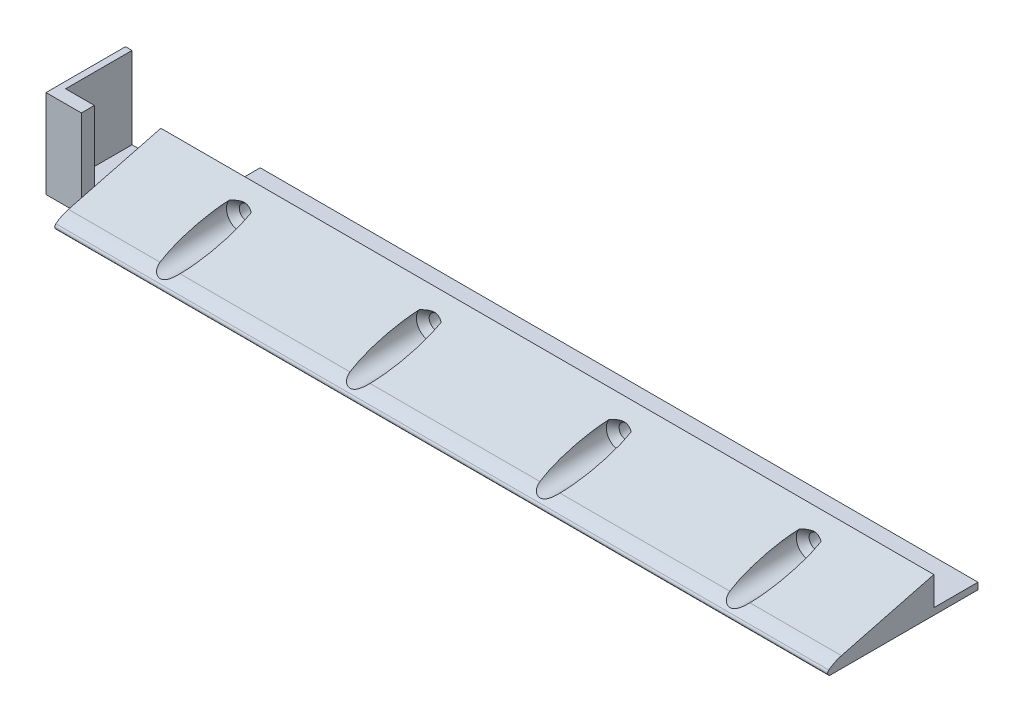
from build123d import *

# Parameters (mm, degrees)
BOSS_EXTRUDE1_DEPTH                          = 175
FILLET1_R                                    = 8
CSK_FOR_M3_COUNTERSUNK_FLAT_HEAD_SCR_2_COUNT = 2
CSK_FOR_M3_COUNTERSUNK_FLAT_HEAD_SCR_2_PITCH = 129
CSK_FOR_M3_COUNTERSUNK_FLAT_HEAD_SCR_3_COUNT = 2
CSK_FOR_M3_COUNTERSUNK_FLAT_HEAD_SCR_3_PITCH = 86
CSK_FOR_M3_COUNTERSUNK_FLAT_HEAD_SCR_4_COUNT = 2
CSK_FOR_M3_COUNTERSUNK_FLAT_HEAD_SCR_4_PITCH = 43
CUT_EXTRUDE2_DEPTH                           = 177.259042321
SKETCH8_W                                    = 12.5
SKETCH8_H                                    = 10
CUT_EXTRUDE3_DEPTH                           = 177.896156092
SKETCH10_W                                   = 8
SKETCH10_H                                   = 18
BOSS_EXTRUDE2_DEPTH                          = 1.5
BOSS_EXTRUDE3_DEPTH                          = 18.5
FILLET2_R                                    = 0.65


with BuildPart() as part:
    # Sketch1 → Boss-Extrude1 (new body)
    with BuildSketch(Plane(origin=(0, 0, 0), x_dir=(0, 0, -1), z_dir=(1, 0, 0))):
        Polygon((0, 6.5), (-25, 0), (-25, -1.5), (10, -1.5), (10, 0), (0, 0), align=None)
    extrude(amount=BOSS_EXTRUDE1_DEPTH)

    # Fillet1
    # the kernel refuses this fillet: 8 mm, written as the material it takes off along each edge
    with BuildSketch(Plane(origin=(-10.545555265, 0, 25), x_dir=(0, 0.2516338517649508, -0.967822506788272), z_dir=(1, 0, 0))) as fillet1_piece_1:
        with BuildLine():
            CenterArc((4.218222106, -8), FILLET1_R, 90, 35.061762164)
            Line((-0.377450778, -1.45173376), (-0.469364235, -1.320768435))
            ThreePointArc((-0.469364235, -1.320768435), (-0.34357699, -0.685605464), (-0.154851601, 0.040261416))
            Line((-0.154851601, 0.040261416), (0, 0.16))
            Line((0, 0.16), (4.218222106, 0.16))
            Line((4.218222106, 0.16), (4.218222106, 0))
        make_face()
    extrude(amount=196.091110529, mode=Mode.SUBTRACT)

    # Sketch5 → CSK for M3 Countersunk Flat Head Screw1 (revolve, cut)
    with BuildSketch(Plane(origin=(152, 3.25, 5), x_dir=(0, -1, 0), z_dir=(1, 0, 0))):
        Polygon((0, 0), (0, 15), (1.7, 15), (1.7, 1.45), (3.15, 0), align=None)
    csk_for_m3_countersunk_flat_head_screw1 = revolve(axis=Axis((152, 3.25, 11.35), (0, 0, -1)), mode=Mode.SUBTRACT)

    # CSK for M3 Countersunk Flat Head Scr 2: CSK for M3 Countersunk Flat Head Screw1 ×2
    with Locations(*[(-i * CSK_FOR_M3_COUNTERSUNK_FLAT_HEAD_SCR_2_PITCH, 0, 0) for i in range(1, CSK_FOR_M3_COUNTERSUNK_FLAT_HEAD_SCR_2_COUNT)]):
        add(csk_for_m3_countersunk_flat_head_screw1, mode=Mode.SUBTRACT)

    # CSK for M3 Countersunk Flat Head Scr 3: CSK for M3 Countersunk Flat Head Screw1 ×2
    with Locations(*[(-i * CSK_FOR_M3_COUNTERSUNK_FLAT_HEAD_SCR_3_PITCH, 0, 0) for i in range(1, CSK_FOR_M3_COUNTERSUNK_FLAT_HEAD_SCR_3_COUNT)]):
        add(csk_for_m3_countersunk_flat_head_screw1, mode=Mode.SUBTRACT)

    # CSK for M3 Countersunk Flat Head Scr 4: CSK for M3 Countersunk Flat Head Screw1 ×2
    with Locations(*[(-i * CSK_FOR_M3_COUNTERSUNK_FLAT_HEAD_SCR_4_PITCH, 0, 0) for i in range(1, CSK_FOR_M3_COUNTERSUNK_FLAT_HEAD_SCR_4_COUNT)]):
        add(csk_for_m3_countersunk_flat_head_screw1, mode=Mode.SUBTRACT)

    # Sketch7 → Cut-Extrude2 (cut, through all)
    with BuildSketch(Plane(origin=(0, 0, 5), x_dir=(-1, 0, 0), z_dir=(0, 0, -1))):
        with BuildLine():
            Line((-149.526136625, 5.2), (-154.473863375, 5.2))
            ThreePointArc((-154.473863375, 5.2), (-152, 0.1), (-149.526136625, 5.2))
        make_face()
        with BuildLine():
            Line((-20.526136625, 5.2), (-25.473863375, 5.2))
            ThreePointArc((-25.473863375, 5.2), (-23, 0.1), (-20.526136625, 5.2))
        make_face()
        with BuildLine():
            Line((-63.526136625, 5.2), (-68.473863375, 5.2))
            ThreePointArc((-68.473863375, 5.2), (-66, 0.1), (-63.526136625, 5.2))
        make_face()
        with BuildLine():
            Line((-106.526136625, 5.2), (-111.473863375, 5.2))
            ThreePointArc((-111.473863375, 5.2), (-109, 0.1), (-106.526136625, 5.2))
        make_face()
    extrude(amount=-CUT_EXTRUDE2_DEPTH, mode=Mode.SUBTRACT)

    # Sketch8 → Cut-Extrude3 (cut, through all)
    with BuildSketch(Plane(origin=(0, 0, 0), x_dir=(1, 0, 0), z_dir=(0, 1, 0))):
        with Locations((6.25, 5)):
            Rectangle(SKETCH8_W, SKETCH8_H)
    extrude(amount=-CUT_EXTRUDE3_DEPTH, mode=Mode.SUBTRACT)

    # Sketch10 → Boss-Extrude2 (add)
    with BuildSketch(Plane.XZ.offset(1.5)):
        with Locations((-4, 9)):
            Rectangle(SKETCH10_W, SKETCH10_H)
    extrude(amount=-BOSS_EXTRUDE2_DEPTH)

    # Sketch11 → Boss-Extrude3 (add)
    with BuildSketch(Plane(origin=(0, 0, 0), x_dir=(1, 0, 0), z_dir=(0, 1, 0))):
        Polygon((-6.52, -15.05), (-6.52, 0), (-8, 0), (-8, -18), (0, -18), (0, -15.05), align=None)
    extrude(amount=BOSS_EXTRUDE3_DEPTH)

    # Fillet2
    fillet2_edges = [part.edges().sort_by_distance(p)[0] for p in [
        (87.5, -1.5, 25),
    ]]
    fillet(fillet2_edges, radius=FILLET2_R)


solid = part.part
